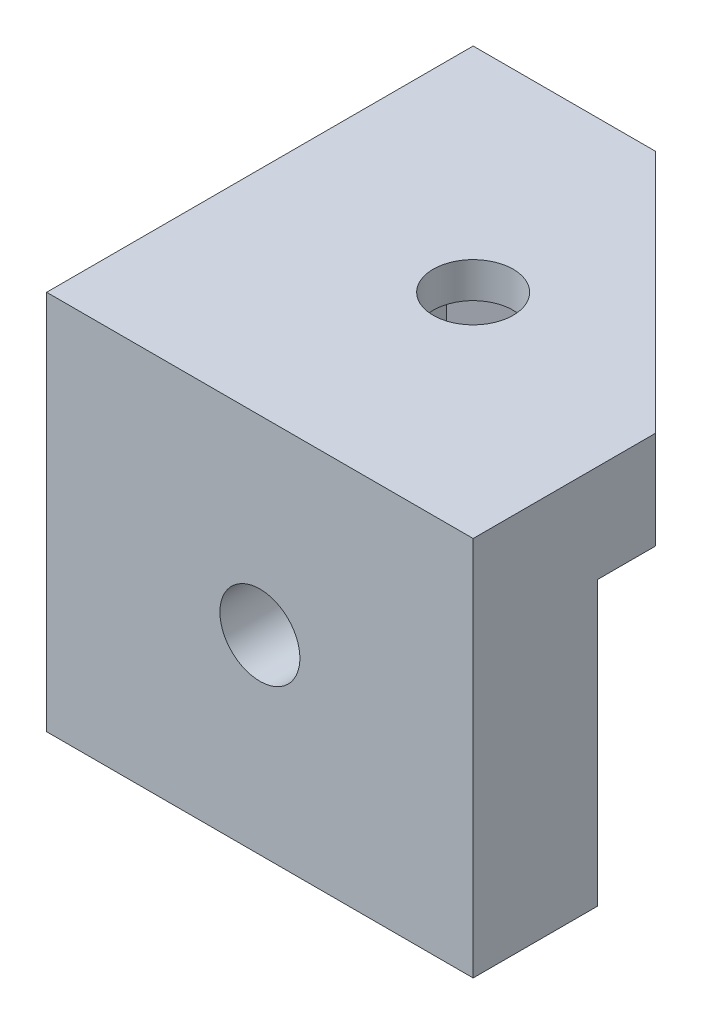
from build123d import *

# Parameters (mm, degrees)
SKETCH1_W                    = 38.1
SKETCH1_H                    = 38.1
MAIN_BODY_DEPTH              = 34
F_9_32_RIGHT_RAIL_DEPTH      = 64.712008287
F_9_32_RIGHT_RAIL_DEPTH_BACK = 5.55625
SKETCH3_R                    = 3.571875
SKETCH4_R                    = 3.571875
F_9_32_LEFT_RAIL_DEPTH       = 5.55625
F_9_32_TOPPER_DEPTH          = 64.712008287
F_9_32_TOPPER_DEPTH_BACK     = 10
SKETCH8_R                    = 3.571875
HEX_START                    = -5.55625
HEX_HOLE_RIGHT_DEPTH         = 32.54375
HEX_HOLE_LEFT_DEPTH          = 32.54375
INNER_START                  = -34
INNER_CAVITY_OUTLINE_W       = 26.9875
INNER_CAVITY_OUTLINE_H       = 26.9875
INNER_CAVITY_DEPTH           = 25.26875
HEX_START_2                  = -17
HEX_HOLE_TOP_DEPTH           = 13.825
TOP_CORNER_REACH             = 65.712
SKETCH17_W                   = 1.5875
SKETCH17_H                   = 1.5875
CUT_EXTRUDE1_DEPTH           = 0.396875


# Read off the part's stored shape, not the designer's step: Inner Cavity
with BuildPart() as part:
    # Sketch1 → Main Body (new body)
    with BuildSketch(Plane(origin=(0, 0, 0), x_dir=(1, 0, 0), z_dir=(0, 1, 0))):
        with Locations((19.05, 19.05)):
            Rectangle(SKETCH1_W, SKETCH1_H)
    extrude(amount=MAIN_BODY_DEPTH)

    # Sketch3 → 9/32 Right Rail (cut, two sides: drawn at the far end of the back side and taken through both)
    with BuildSketch(Plane.XY.offset(-F_9_32_RIGHT_RAIL_DEPTH_BACK)):
        with Locations(Location((19.05, 17, 0), (0, 0, 180))):
            Circle(SKETCH3_R)
    extrude(amount=F_9_32_RIGHT_RAIL_DEPTH + F_9_32_RIGHT_RAIL_DEPTH_BACK, mode=Mode.SUBTRACT)

    # Sketch4 → 9/32 Left Rail (cut)
    with BuildSketch(Plane.ZY):
        with Locations((-19.05, 17)):
            Circle(SKETCH4_R)
    extrude(amount=-F_9_32_LEFT_RAIL_DEPTH, mode=Mode.SUBTRACT)

    # Sketch8 → 9/32 Topper (cut, two sides: drawn at the far end of the back side and taken through both)
    with BuildSketch(Plane(origin=(0, 34, 0), x_dir=(1, 0, 0), z_dir=(0, 1, 0)).offset(-F_9_32_TOPPER_DEPTH_BACK)):
        with Locations(Location((19.05, 19.05, 0), (0, 0, 90))):
            Circle(SKETCH8_R)
    extrude(amount=F_9_32_TOPPER_DEPTH + F_9_32_TOPPER_DEPTH_BACK, mode=Mode.SUBTRACT)

    # Sketch9 → Hex Hole Right (cut)
    with BuildSketch(Plane.ZY.offset(HEX_START)):
        Polygon((-22.315182739, 22.6554624), (-25.580365478, 17), (-22.315182739, 11.3445376), (-15.784817261, 11.3445376), (-12.519634522, 17), (-15.784817261, 22.6554624), align=None)
    extrude(amount=-HEX_HOLE_RIGHT_DEPTH, mode=Mode.SUBTRACT)

    # Sketch10 → Hex Hole Left (cut)
    with BuildSketch(Plane.XY.offset(HEX_START)):
        Polygon((15.784813595, 22.65546875), (12.51962719, 17), (15.784813595, 11.34453125), (22.315186405, 11.34453125), (25.58037281, 17), (22.315186405, 22.65546875), align=None)
    extrude(amount=-HEX_HOLE_LEFT_DEPTH, mode=Mode.SUBTRACT)

    # Inner Cavity outline → Inner Cavity (cut)
    with BuildSketch(Plane(origin=(0, 34, 0), x_dir=(1, 0, 0), z_dir=(0, 1, 0)).offset(INNER_START)):
        with Locations((24.60625, 24.60625)):
            Rectangle(INNER_CAVITY_OUTLINE_W, INNER_CAVITY_OUTLINE_H)
    extrude(amount=INNER_CAVITY_DEPTH, mode=Mode.SUBTRACT)

    # Sketch14 → Hex Hole Top (cut)
    with BuildSketch(Plane(origin=(0, 34, 0), x_dir=(1, 0, 0), z_dir=(0, 1, 0)).offset(HEX_START_2)):
        Polygon((24.70546875, 22.315186405), (19.05, 25.58037281), (13.39453125, 22.315186405), (13.39453125, 15.784813595), (19.05, 12.51962719), (24.70546875, 15.784813595), align=None)
    extrude(amount=HEX_HOLE_TOP_DEPTH, mode=Mode.SUBTRACT)

    # Sketch16 → Top Corner (cut, up to next)
    with BuildSketch(Plane(origin=(0, 34, 0), x_dir=(1, 0, 0), z_dir=(0, 1, 0)), mode=Mode.PRIVATE) as top_corner_sk1:
        Polygon((38.1, 38.1), (16.276714219, 38.1), (38.1, 16.276714219), align=None)
    top_corner_tool1 = extrude(top_corner_sk1.sketch, amount=-TOP_CORNER_REACH, mode=Mode.PRIVATE) & part.part
    add(top_corner_tool1.solids().sort_by_distance((30.825571, 34, -30.825571))[0], mode=Mode.SUBTRACT)

    # Sketch17 → Cut-Extrude1 (cut)
    with BuildSketch(Plane.XZ):
        with Locations((19.05, -5.55625)):
            Rectangle(SKETCH17_W, SKETCH17_H)
        with Locations((5.55625, -17.4625)):
            Rectangle(SKETCH17_W, SKETCH17_H)
        with Locations((5.55625, -20.6375)):
            Rectangle(SKETCH17_W, SKETCH17_H)
    extrude(amount=-CUT_EXTRUDE1_DEPTH, mode=Mode.SUBTRACT)


solid = part.part
